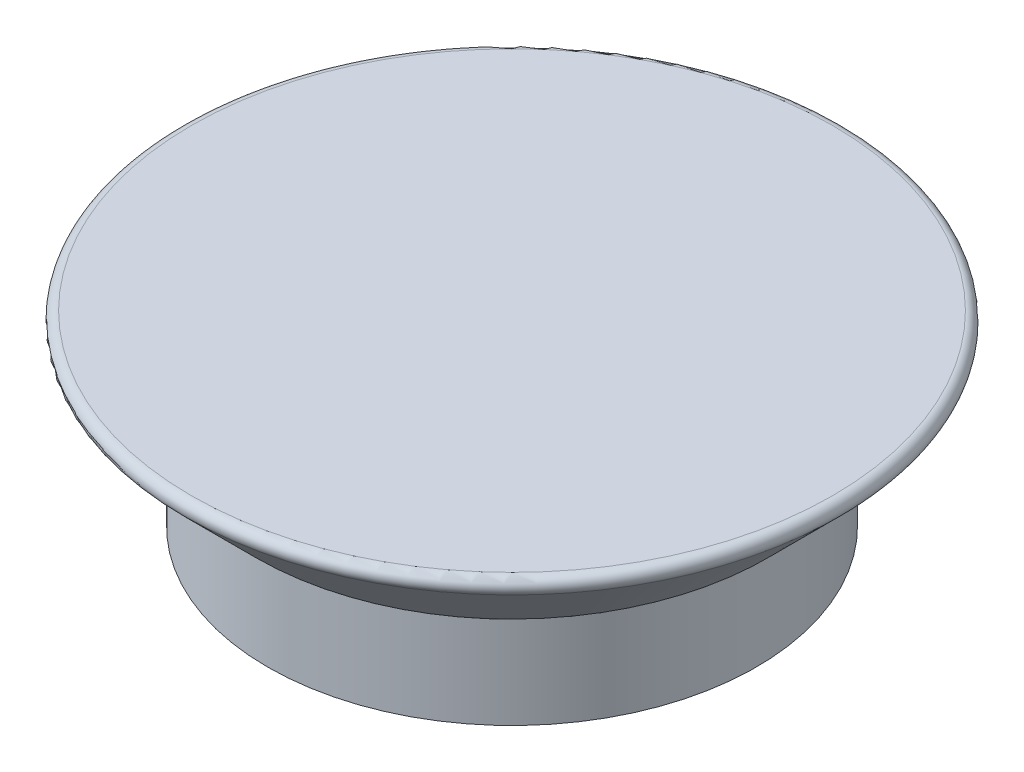
from build123d import *

# Parameters (mm, degrees)
SKETCH1_R           = 275
BOSS_EXTRUDE1_DEPTH = 110
SKETCH2_R           = 375
BOSS_EXTRUDE2_DEPTH = 100
CHAMFER1_SIZE       = 90
FILLET1_R           = 10
FILLET2_R           = 10


with BuildPart() as part:
    # Sketch1 → Boss-Extrude1 (new body)
    with BuildSketch(Plane(origin=(0, 0, 0), x_dir=(1, 0, 0), z_dir=(0, 1, 0))):
        with Locations(Location((0, 0, 0), (0, 0, 270))):
            Circle(SKETCH1_R)
    extrude(amount=BOSS_EXTRUDE1_DEPTH)

    # Sketch2 → Boss-Extrude2 (add)
    with BuildSketch(Plane(origin=(0, 110, 0), x_dir=(1, 0, 0), z_dir=(0, 1, 0))):
        with Locations(Location((0, 0, 0), (0, 0, 270))):
            Circle(SKETCH2_R)
    extrude(amount=BOSS_EXTRUDE2_DEPTH)

    # Chamfer1
    chamfer1_edges = [part.edges().sort_by_distance(p)[0] for p in [
        (0, 110, -375),
    ]]
    chamfer(chamfer1_edges, length=CHAMFER1_SIZE)

    # Fillet1
    fillet1_edges = [part.edges().sort_by_distance(p)[0] for p in [
        (0, 110, -285),
        (0, 210, -375),
    ]]
    fillet(fillet1_edges, radius=FILLET1_R - 0.0001)  # a hair under: the kernel refuses the full size

    # Fillet2
    fillet2_edges = [part.edges().sort_by_distance(p)[0] for p in [
        (0, 200, -375),
    ]]
    fillet(fillet2_edges, radius=FILLET2_R - 0.0004)  # a hair under: the kernel refuses the full size


solid = part.part
